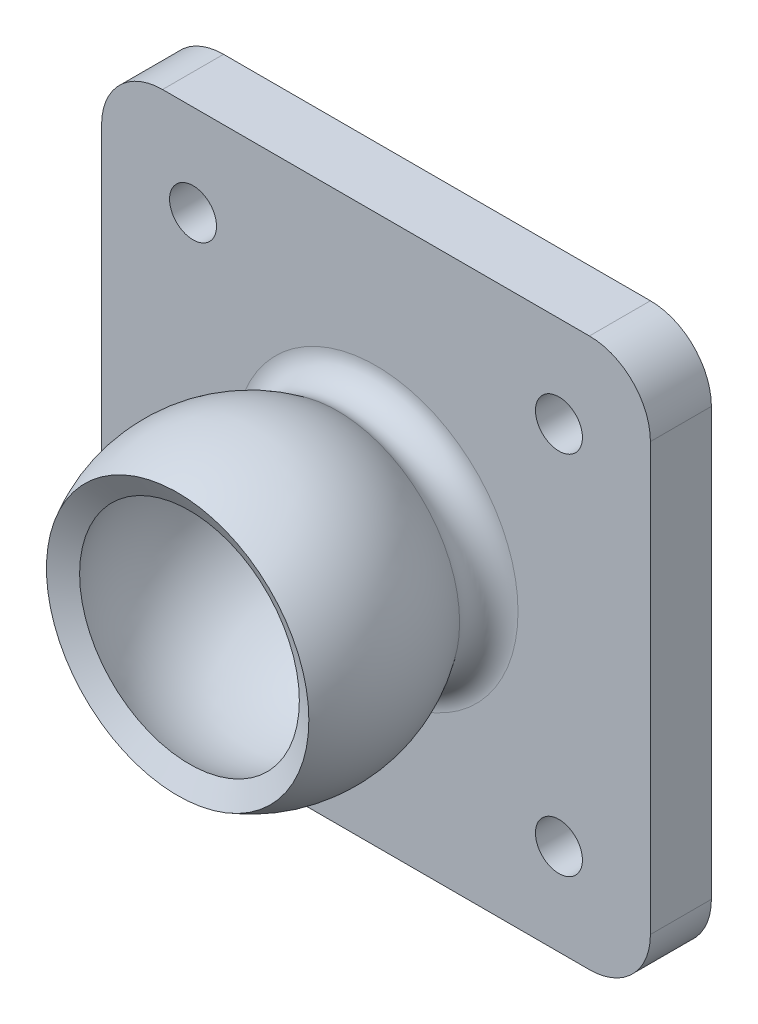
from build123d import *

# Parameters (mm, degrees)
SKETCH1_W           = 45
SKETCH1_H           = 45
BOSS_EXTRUDE1_DEPTH = 5
FILLET1_R           = 5
SKETCH2_R           = 1.925
CUT_EXTRUDE1_DEPTH  = 33.210246817
FILLET2_R           = 2


with BuildPart() as part:
    # Sketch1 → Boss-Extrude1 (new body)
    with BuildSketch(Plane.XY):
        Rectangle(SKETCH1_W, SKETCH1_H)
    extrude(amount=BOSS_EXTRUDE1_DEPTH)

    # Fillet1
    fillet1_edges = [part.edges().sort_by_distance(p)[0] for p in [
        (22.5, -22.5, 2.5),
        (-22.5, -22.5, 2.5),
        (-22.5, 22.5, 2.5),
        (22.5, 22.5, 2.5),
    ]]
    fillet(fillet1_edges, radius=FILLET1_R)

    # Sketch2 → Cut-Extrude1 (cut, through all)
    with BuildSketch(Plane.XY.offset(5)):
        with Locations((15, 15)):
            Circle(SKETCH2_R)
        with Locations(Location((15, -15, 0), (0, 0, 180))):
            Circle(SKETCH2_R)
        with Locations((-15, -15)):
            Circle(SKETCH2_R)
        with Locations(Location((-15, 15, 0), (0, 0, 180))):
            Circle(SKETCH2_R)
    extrude(amount=-CUT_EXTRUDE1_DEPTH, mode=Mode.SUBTRACT)

    # Sketch3 → Revolve5 (revolve)
    with BuildSketch(Plane(origin=(0, 0, 0), x_dir=(1, 0, 0), z_dir=(0, 1, 0))):
        with BuildLine():
            Line((0, -3), (0, -5))
            ThreePointArc((0, -5), (10.3, -15.3), (0, -25.6))
            Line((0, -25.6), (0, -27.6))
            ThreePointArc((0, -27.6), (12.3, -15.3), (0, -3))
        make_face()
    revolve(axis=Axis((0, 0, 3), (0, 0, 1)))

    # Fillet2
    fillet2_edges = [part.edges().sort_by_distance(p)[0] for p in [
        (-6.723094526, 0, 5),
    ]]
    fillet(fillet2_edges, radius=FILLET2_R)

    # Cut-Revolve9: read off the stored shape, not the designer's step
    # Cut-Revolve9 outline → Cut-Revolve9 (revolve, cut)
    with BuildSketch(Plane.XZ):
        Polygon((9.008582984, 21.263158329), (9.008582984, 20.293539089), (10.757822398, 21.263158329), align=None)
    revolve(axis=Axis((0, 0, 0), (0, 0, 1)), mode=Mode.SUBTRACT)

    # Cut-Revolve9 2 outline → Cut-Revolve9 2 (revolve, cut)
    with BuildSketch(Plane.XZ):
        with BuildLine():
            Line((9.008582984, 21.263158329), (10.757822401, 21.263158323))
            ThreePointArc((10.757822401, 21.263158323), (6.242721867, 25.898038672), (0, 27.6))
            Line((0, 27.6), (0, 25.6))
            ThreePointArc((0, 25.6), (5.227645138, 24.174780353), (9.008582983, 20.293539089))
            Line((9.008582983, 20.293539089), (9.008582984, 21.263158329))
        make_face()
    revolve(axis=Axis((0, 0, 0), (0, 0, 1)), mode=Mode.SUBTRACT)


solid = part.part
